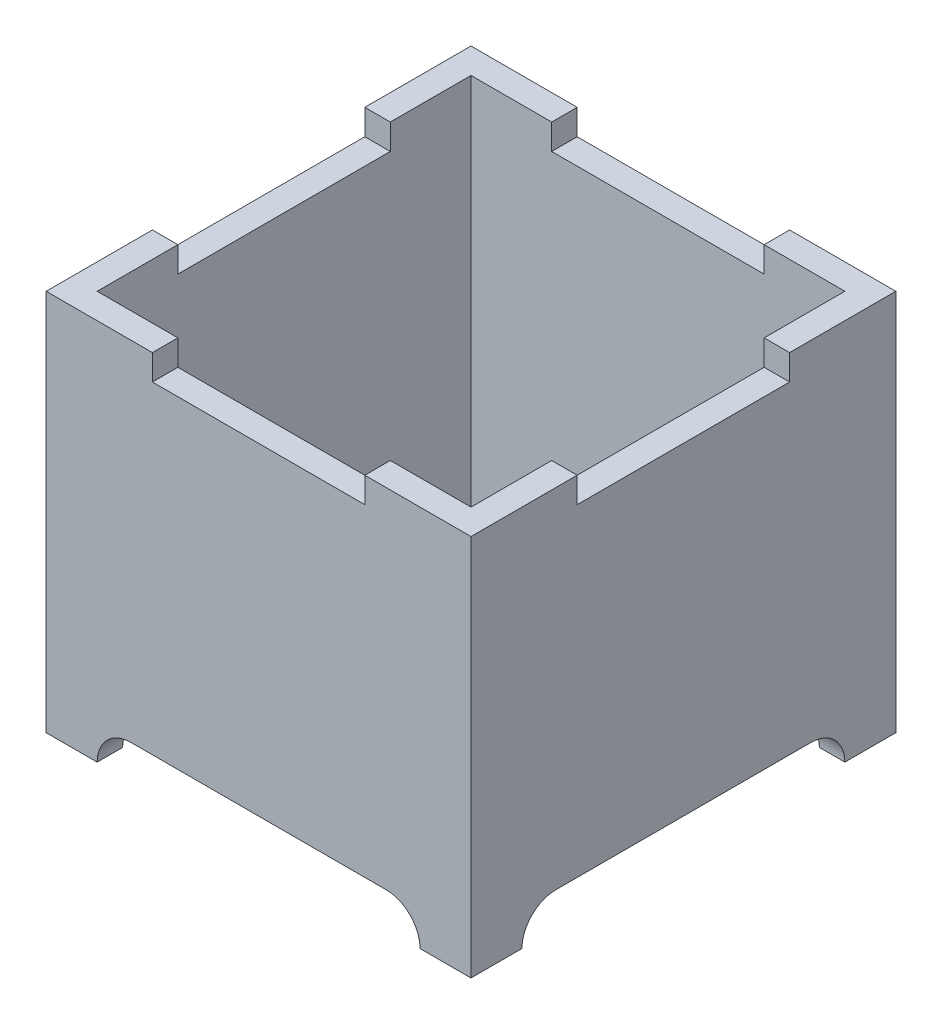
from build123d import *

# Parameters (mm, degrees)
ESQUISSE2_W             = 50
ESQUISSE2_H             = 50
BOSS_EXTRU_2_DEPTH      = 45
ESQUISSE4_W             = 44
ESQUISSE4_H             = 44
ENL_V_MAT_EXTRU_3_DEPTH = 45
ESQUISSE5_W             = 25
ESQUISSE5_H             = 3
ENL_V_MAT_EXTRU_4_DEPTH = 57
ESQUISSE6_W             = 25
ESQUISSE6_H             = 3
ENL_V_MAT_EXTRU_5_DEPTH = 57
ESQUISSE7_W             = 38
ESQUISSE7_H             = 4
ENL_V_MAT_EXTRU_6_DEPTH = 57
ESQUISSE8_W             = 38
ESQUISSE8_H             = 4
ENL_V_MAT_EXTRU_7_DEPTH = 57
CONG_1_R                = 4


with BuildPart() as part:
    # Esquisse2 → Boss.-Extru.2 (new body)
    with BuildSketch(Plane(origin=(0, 0, 0), x_dir=(1, 0, 0), z_dir=(0, 1, 0))):
        with Locations((25, 25)):
            Rectangle(ESQUISSE2_W, ESQUISSE2_H)
    extrude(amount=-BOSS_EXTRU_2_DEPTH)

    # Esquisse4 → Enlèv. mat.-Extru.3 (cut)
    with BuildSketch(Plane(origin=(0, 0, 0), x_dir=(1, 0, 0), z_dir=(0, 1, 0))):
        with Locations((25, 25)):
            Rectangle(ESQUISSE4_W, ESQUISSE4_H)
    extrude(amount=-ENL_V_MAT_EXTRU_3_DEPTH, mode=Mode.SUBTRACT)

    # Esquisse5 → Enlèv. mat.-Extru.4 (cut)
    with BuildSketch(Plane.XY):
        with Locations((25, -1.5)):
            Rectangle(ESQUISSE5_W, ESQUISSE5_H)
    extrude(amount=-ENL_V_MAT_EXTRU_4_DEPTH, mode=Mode.SUBTRACT)

    # Esquisse6 → Enlèv. mat.-Extru.5 (cut)
    with BuildSketch(Plane(origin=(50, 0, 0), x_dir=(0, 0, -1), z_dir=(1, 0, 0))):
        with Locations((25, -1.5)):
            Rectangle(ESQUISSE6_W, ESQUISSE6_H)
    extrude(amount=-ENL_V_MAT_EXTRU_5_DEPTH, mode=Mode.SUBTRACT)

    # Esquisse7 → Enlèv. mat.-Extru.6 (cut)
    with BuildSketch(Plane.XY):
        with Locations((25, -43)):
            Rectangle(ESQUISSE7_W, ESQUISSE7_H)
    extrude(amount=-ENL_V_MAT_EXTRU_6_DEPTH, mode=Mode.SUBTRACT)

    # Esquisse8 → Enlèv. mat.-Extru.7 (cut)
    with BuildSketch(Plane(origin=(50, 0, 0), x_dir=(0, 0, -1), z_dir=(1, 0, 0))):
        with Locations((25, -43)):
            Rectangle(ESQUISSE8_W, ESQUISSE8_H)
    extrude(amount=-ENL_V_MAT_EXTRU_7_DEPTH, mode=Mode.SUBTRACT)

    # Congé1
    cong_1_edges = [part.edges().sort_by_distance(p)[0] for p in [
        (44, -41, -48.5),
        (44, -41, -1.5),
        (6, -41, -1.5),
        (1.5, -41, -6),
        (1.5, -41, -44),
        (6, -41, -48.5),
        (48.5, -41, -44),
        (48.5, -41, -6),
    ]]
    fillet(cong_1_edges, radius=CONG_1_R - 0.0001)  # a hair under: the kernel refuses the full size


solid = part.part
